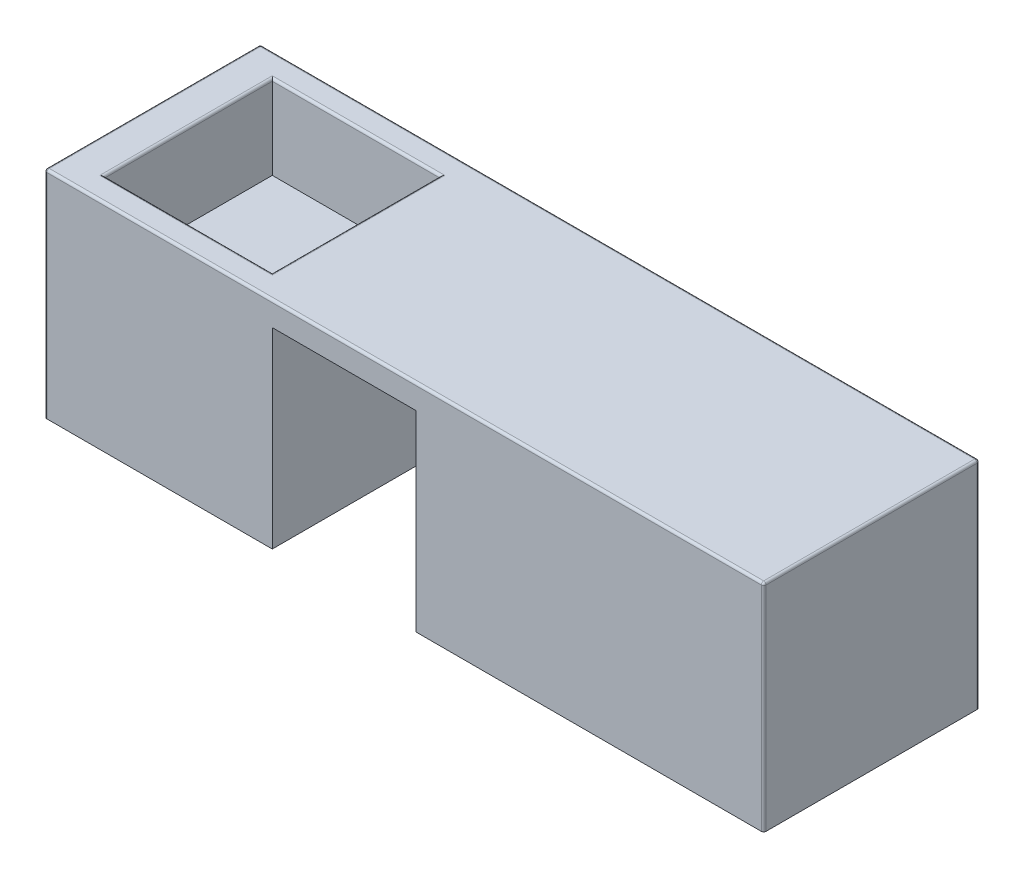
from build123d import *

# Parameters (mm, degrees)
SKETCH1_W               = 3000
SKETCH1_H               = 900
BOSS_EXTRUDE1_DEPTH     = 900
CUT_EXTRUDE2_DEPTH      = 1968.231557291
CUT_EXTRUDE2_DEPTH_BACK = 800
SKETCH2_W               = 700
SKETCH2_H               = 700
CUT_EXTRUDE3_DEPTH      = 350
FILLET1_R               = 10
FILLET2_R               = 10


with BuildPart() as part:
    # Sketch1 → Boss-Extrude1 (new body)
    with BuildSketch(Plane(origin=(0, 0, 0), x_dir=(1, 0, 0), z_dir=(0, 1, 0))):
        Rectangle(SKETCH1_W, SKETCH1_H)
    extrude(amount=BOSS_EXTRUDE1_DEPTH)

    # Sketch3 → Cut-Extrude2 (cut, two sides: drawn at the far end of the back side and taken through both)
    with BuildSketch(Plane.XY.offset(450).offset(-CUT_EXTRUDE2_DEPTH_BACK)):
        Polygon((50, -4487.722635448), (50, 0), (50, 800), (-550, 800), (-550, 0), (-550, -4487.722635448), (-550, -13463.167906343), (50, -13463.167906343), align=None)
    extrude(amount=CUT_EXTRUDE2_DEPTH + CUT_EXTRUDE2_DEPTH_BACK, mode=Mode.SUBTRACT)

    # Sketch2 → Cut-Extrude3 (cut)
    with BuildSketch(Plane(origin=(0, 900, 0), x_dir=(1, 0, 0), z_dir=(0, 1, 0))):
        with Locations((-1000, 0)):
            Rectangle(SKETCH2_W, SKETCH2_H)
    extrude(amount=-CUT_EXTRUDE3_DEPTH, mode=Mode.SUBTRACT)

    # Fillet1
    fillet1_edges = [part.edges().sort_by_distance(p)[0] for p in [
        (-1500, 900, 0),
        (0, 900, 450),
        (-1350, 900, 0),
        (-1000, 900, 350),
        (-650, 900, 0),
        (-1000, 900, -350),
        (1500, 900, 0),
        (0, 900, -450),
    ]]
    fillet(fillet1_edges, radius=FILLET1_R)

    # Fillet2
    # the kernel refuses this fillet: 10 mm, written as the material it takes off along each edge
    with BuildSketch(Plane(origin=(-1490, 890, -440), x_dir=(0, 0, -1), z_dir=(-1, 0, 0))) as fillet2_piece_1_section:
        Polygon((0, 0), (FILLET2_R, 0), (FILLET2_R, -FILLET2_R), (0, -FILLET2_R), align=None)
    fillet2_piece_1 = extrude(amount=FILLET2_R, mode=Mode.PRIVATE)
    fillet2_piece_1 = fillet2_piece_1 - Plane(origin=(-1490, 890, -440), x_dir=(0, -0.7071067811865475, 0.7071067811865475), z_dir=(-1, 0, 0)) * Sphere(FILLET2_R, mode=Mode.PRIVATE)
    add(fillet2_piece_1, mode=Mode.SUBTRACT)
    with BuildSketch(Plane(origin=(1490, 890, -440), x_dir=(0, 0, -1), z_dir=(1, 0, 0))) as fillet2_piece_2_section:
        Polygon((0, 0), (FILLET2_R, 0), (FILLET2_R, FILLET2_R), (0, FILLET2_R), align=None)
    fillet2_piece_2 = extrude(amount=FILLET2_R, mode=Mode.PRIVATE)
    fillet2_piece_2 = fillet2_piece_2 - Plane(origin=(1490, 890, -440), x_dir=(0, -0.7071067811865475, 0.7071067811865475), z_dir=(1, 0, 0)) * Sphere(FILLET2_R, mode=Mode.PRIVATE)
    add(fillet2_piece_2, mode=Mode.SUBTRACT)
    with BuildSketch(Plane(origin=(-1490, 890, 440), x_dir=(-1, 0, 0), z_dir=(0, 0, 1))) as fillet2_piece_3_section:
        Polygon((0, 0), (FILLET2_R, 0), (FILLET2_R, -FILLET2_R), (0, -FILLET2_R), align=None)
    fillet2_piece_3 = extrude(amount=FILLET2_R, mode=Mode.PRIVATE)
    fillet2_piece_3 = fillet2_piece_3 - Plane(origin=(-1490, 890, 440), x_dir=(0.7071067811865475, -0.7071067811865475, 0), z_dir=(0, 0, 1)) * Sphere(FILLET2_R, mode=Mode.PRIVATE)
    add(fillet2_piece_3, mode=Mode.SUBTRACT)
    with BuildSketch(Plane(origin=(1490, 890, 440), x_dir=(1, 0, 0), z_dir=(0, 0, 1))) as fillet2_piece_4_section:
        Polygon((0, 0), (FILLET2_R, 0), (FILLET2_R, FILLET2_R), (0, FILLET2_R), align=None)
    fillet2_piece_4 = extrude(amount=FILLET2_R, mode=Mode.PRIVATE)
    fillet2_piece_4 = fillet2_piece_4 - Plane(origin=(1490, 890, 440), x_dir=(-0.7071067811865475, -0.7071067811865475, 0), z_dir=(0, 0, 1)) * Sphere(FILLET2_R, mode=Mode.PRIVATE)
    add(fillet2_piece_4, mode=Mode.SUBTRACT)
    with BuildSketch(Plane(origin=(1500, -25, 450), x_dir=(-1, 0, 0), z_dir=(0, 1, 0)), Plane(origin=(1500, -25, -450), x_dir=(0, 0, 1), z_dir=(0, 1, 0))) as fillet2_piece_5:
        with BuildLine():
            CenterArc((FILLET2_R, -FILLET2_R), FILLET2_R, 90, 90)
            Line((0, -FILLET2_R), (0, 0))
            Line((0, 0), (FILLET2_R, 0))
        make_face()
    extrude(amount=915, mode=Mode.SUBTRACT)
    with BuildSketch(Plane(origin=(-1500, -25, 450), x_dir=(1, 0, 0), z_dir=(0, 1, 0)), Plane(origin=(-1500, -25, -450), x_dir=(0, 0, 1), z_dir=(0, 1, 0))) as fillet2_piece_6:
        with BuildLine():
            CenterArc((FILLET2_R, FILLET2_R), FILLET2_R, 180, 90)
            Line((0, FILLET2_R), (0, 0))
            Line((0, 0), (FILLET2_R, 0))
        make_face()
    extrude(amount=915, mode=Mode.SUBTRACT)


solid = part.part
